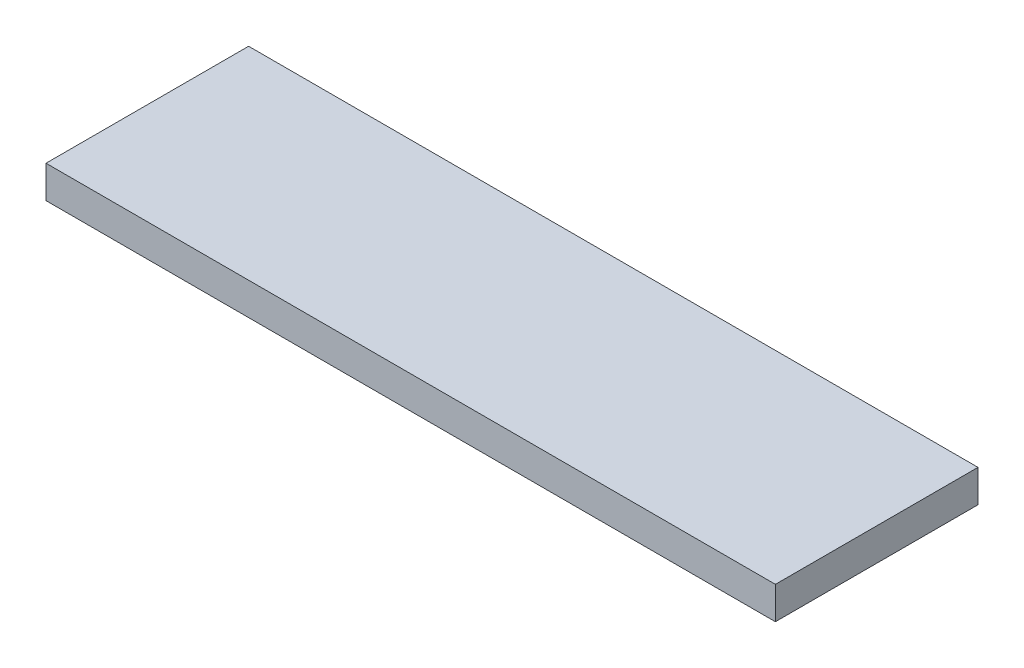
from build123d import *

# Parameters (mm, degrees)
SKETCH1_W           = 45
SKETCH1_H           = 12.5
BOSS_EXTRUDE1_DEPTH = 2


with BuildPart() as part:
    # Sketch1 → Boss-Extrude1 (new body)
    with BuildSketch(Plane(origin=(0, 0, 0), x_dir=(1, 0, 0), z_dir=(0, 1, 0))):
        with Locations((22.5, 6.25)):
            Rectangle(SKETCH1_W, SKETCH1_H)
    extrude(amount=BOSS_EXTRUDE1_DEPTH)


solid = part.part
